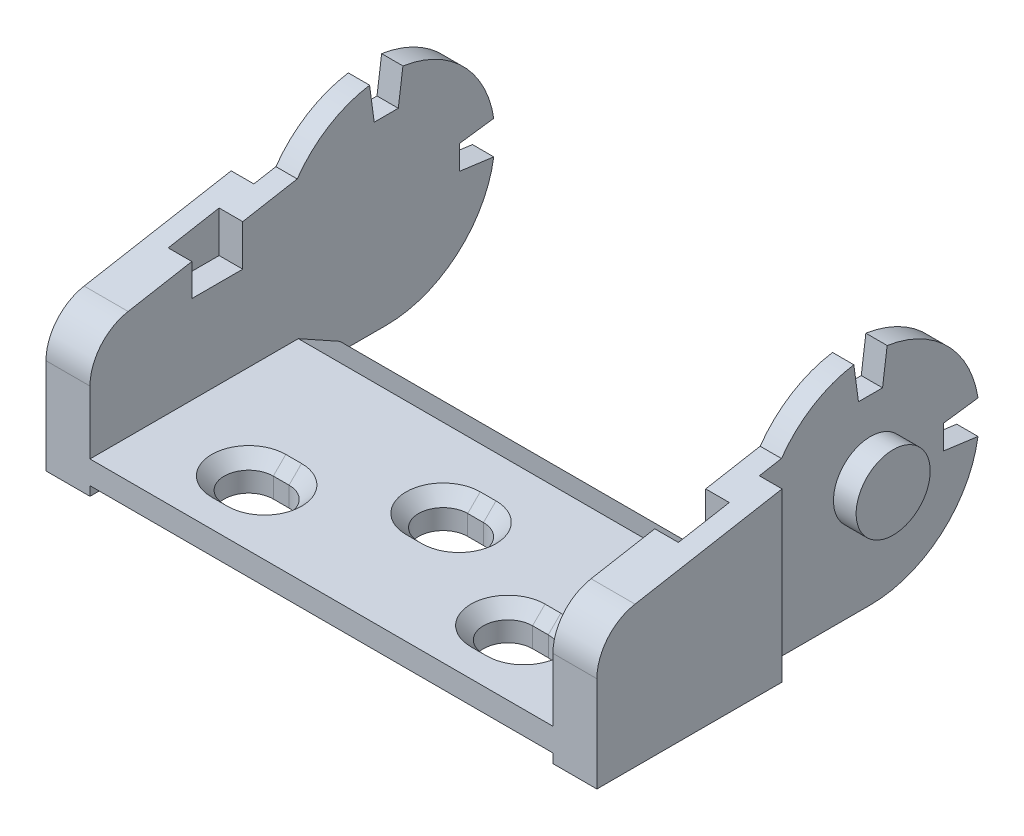
from build123d import *

# Parameters (mm, degrees)
BODY_DEPTH                       = 32
BODY_DEPTH_BACK                  = 15
PIVOT_START                      = 25
PIVOT_PIN_R_SKETCH_R             = 4
PIVOT_PIN_R_DEPTH                = 4.25
OUTSIDE_SHAPE_CUT_OUT_DEPTH      = 46.245165488
OUTSIDE_SHAPE_CUT_OUT_DEPTH_BACK = 46.245165488
OUTSIDE_SHAPE_CUT_OUT_SKETCH_W   = 49
OUTSIDE_SHAPE_CUT_OUT_SKETCH_H   = 25.5
OUTSIDE_START                    = 27.3
OUTSIDE_SHAPE_CUT_OUT_SKETCH_R_W = 24
OUTSIDE_SHAPE_CUT_OUT_SKETCH_R_H = 24
OUTSIDE_SHAPE_CUT_OUT_SKETCH_R_R = 4
OUTSIDE_SHAPE_CUT_OUT_R_DEPTH    = 18.945165488
INSIDE_START                     = 25
INSIDE_SHAPE_CUT_OUT_DEPTH       = 50
LIGHTENING_START                 = 1.25
LIGHTENING_2_SKETCH_W            = 55.1
LIGHTENING_2_SKETCH_H            = 5.5
LIGHTENING_2_DEPTH               = 44.995165488
F_3_START                        = -11.75
F_3_M5_SLOTS_DEPTH               = 3.5


with BuildPart() as part:
    # Profile Sketch → Body (new, two sides: drawn at the far end of the back side and taken through both)
    with BuildSketch(Plane.XY.offset(-BODY_DEPTH_BACK)):
        Polygon((-29.75, -11.75), (29.75, -11.75), (29.75, 11.75), (25, 11.75), (25, -8.25), (-25, -8.25), (-25, 11.75), (-29.75, 11.75), align=None)
    extrude(amount=BODY_DEPTH + BODY_DEPTH_BACK)

    # Pivot Pin R Sketch → Pivot Pin R (add)
    with BuildSketch(Plane(origin=(0, 0, 0), x_dir=(0, 0, -1), z_dir=(1, 0, 0)).offset(PIVOT_START)):
        Circle(PIVOT_PIN_R_SKETCH_R)
    pivot_pin_r = extrude(amount=PIVOT_PIN_R_DEPTH)

    # Pivot Pin L: Pivot Pin R across plane
    add(pivot_pin_r.mirror(Plane(origin=(0, 0, 0), x_dir=(0, 0, 1), z_dir=(1, 0, 0))))

    # Outside Shape Cut Out Sketch → Outside Shape Cut Out (cut, two sides: drawn at the far end of the back side and taken through both)
    with BuildSketch(Plane(origin=(0, 0, 0), x_dir=(0, 0, -1), z_dir=(1, 0, 0)).offset(-OUTSIDE_SHAPE_CUT_OUT_DEPTH_BACK)):
        with Locations((-9.5, -1)):
            Rectangle(OUTSIDE_SHAPE_CUT_OUT_SKETCH_W, OUTSIDE_SHAPE_CUT_OUT_SKETCH_H)
        with BuildLine():
            Line((-27.879626464, 3.486362585), (-9.617692031, 6.75))
            ThreePointArc((-9.617692031, 6.75), (-6.204756601, 9.978150907), (-1.8, 11.611309142))
            Line((-1.8, 11.611309142), (-1.3, 7.9))
            Line((-1.3, 7.9), (1.3, 7.9))
            Line((1.3, 7.9), (1.8, 11.611309142))
            ThreePointArc((1.8, 11.611309142), (8.308504679, 8.308504679), (11.611309142, 1.8))
            Line((11.611309142, 1.8), (7.9, 1.3))
            Line((7.9, 1.3), (7.9, -1.3))
            Line((7.9, -1.3), (11.611309142, -1.8))
            ThreePointArc((11.611309142, -1.8), (7.645668708, -8.922233465), (0, -11.75))
            Line((0, -11.75), (-32, -11.75))
            Line((-32, -11.75), (-32, -1.435655018))
            ThreePointArc((-32, -1.435655018), (-30.833936118, 1.773851772), (-27.879626464, 3.486362585))
        make_face(mode=Mode.SUBTRACT)
    extrude(amount=OUTSIDE_SHAPE_CUT_OUT_DEPTH + OUTSIDE_SHAPE_CUT_OUT_DEPTH_BACK, mode=Mode.SUBTRACT)

    # Outside Shape Cut Out Sketch R → Outside Shape Cut Out R (cut, through all)
    with BuildSketch(Plane(origin=(0, 0, 0), x_dir=(0, 0, -1), z_dir=(1, 0, 0)).offset(OUTSIDE_START)):
        Rectangle(OUTSIDE_SHAPE_CUT_OUT_SKETCH_R_W, OUTSIDE_SHAPE_CUT_OUT_SKETCH_R_H)
        Circle(OUTSIDE_SHAPE_CUT_OUT_SKETCH_R_R, mode=Mode.SUBTRACT)
    outside_shape_cut_out_r = extrude(amount=OUTSIDE_SHAPE_CUT_OUT_R_DEPTH, mode=Mode.SUBTRACT)

    # Outside Shape Cut Out L: Outside Shape Cut Out R across plane
    add(outside_shape_cut_out_r.mirror(Plane(origin=(0, 0, 0), x_dir=(0, 0, 1), z_dir=(1, 0, 0))), mode=Mode.SUBTRACT)

    # Inside Shape Cut Out Sketch → Inside Shape Cut Out (cut)
    with BuildSketch(Plane(origin=(0, 0, 0), x_dir=(0, 0, -1), z_dir=(1, 0, 0)).offset(INSIDE_START)):
        Polygon((-29, -9.75), (-29, -11.75), (-32, -11.75), (-32, -10.75), (-30.5, -10.75), (-30.5, -9.75), align=None)
        Polygon((-9.5, -8.25), (-5, -10.75), (-5, -11.75), (8.366600265, -11.75), (8.366600265, -8.25), align=None)
    extrude(amount=-INSIDE_SHAPE_CUT_OUT_DEPTH, mode=Mode.SUBTRACT)

    # Lightening 2 Sketch → Lightening 2 (cut, through all)
    with BuildSketch(Plane(origin=(0, 0, 0), x_dir=(1, 0, 0), z_dir=(0, 1, 0)).offset(LIGHTENING_START)):
        with Locations((0, -18.25)):
            Rectangle(LIGHTENING_2_SKETCH_W, LIGHTENING_2_SKETCH_H)
    extrude(amount=LIGHTENING_2_DEPTH, mode=Mode.SUBTRACT)

    # 3 M5 Slots: read off the stored shape, not the designer's step
    # 3 M5 Slots outline → 3 M5 Slots (cut)
    with BuildSketch(Plane(origin=(0, 0, 0), x_dir=(1, 0, 0), z_dir=(0, 1, 0)).offset(F_3_START)):
        with BuildLine():
            Line((-0.85, -20.65), (0.85, -20.65))
            ThreePointArc((0.85, -20.65), (3.5, -18), (0.85, -15.35))
            Line((0.85, -15.35), (-0.85, -15.35))
            ThreePointArc((-0.85, -15.35), (-3.5, -18), (-0.85, -20.65))
        make_face()
        with BuildLine():
            Line((13.15, -27.65), (14.85, -27.65))
            ThreePointArc((14.85, -27.65), (17.5, -25), (14.85, -22.35))
            Line((14.85, -22.35), (13.15, -22.35))
            ThreePointArc((13.15, -22.35), (10.5, -25), (13.15, -27.65))
        make_face()
        with BuildLine():
            ThreePointArc((-13.15, -27.65), (-10.5, -25), (-13.15, -22.35))
            Line((-13.15, -22.35), (-14.85, -22.35))
            ThreePointArc((-14.85, -22.35), (-17.5, -25), (-14.85, -27.65))
            Line((-14.85, -27.65), (-13.15, -27.65))
        make_face()
    extrude(amount=F_3_M5_SLOTS_DEPTH, mode=Mode.SUBTRACT)

    # 3 M5 Slots 2: loft between two sections, ruled curve by curve
    f_3_m5_slots_2_from = [
        Edge.make_three_point_arc((0.85, -9.6, 20.65), (2.72383297, -9.6, 19.87383297), (3.5, -9.6, 18)),
        Edge.make_three_point_arc((3.5, -9.6, 18), (2.72383297, -9.6, 16.12616703), (0.85, -9.6, 15.35)),
        Edge.make_three_point_arc((-0.85, -9.6, 15.35), (-2.72383297, -9.6, 16.12616703), (-3.5, -9.6, 18)),
        Edge.make_three_point_arc((-3.5, -9.6, 18), (-2.72383297, -9.6, 19.87383297), (-0.85, -9.6, 20.65)),
        Edge.make_line((0.85, -9.6, 15.35), (-0.85, -9.6, 15.35)),
        Edge.make_line((0.85, -9.6, 20.65), (-0.85, -9.6, 20.65)),
    ]
    f_3_m5_slots_2_to = [
        Edge.make_three_point_arc((0.85, -8.25, 22), (3.678427125, -8.25, 20.828427125), (4.85, -8.25, 18)),
        Edge.make_three_point_arc((4.85, -8.25, 18), (3.678427125, -8.25, 15.171572875), (0.85, -8.25, 14)),
        Edge.make_three_point_arc((-0.85, -8.25, 14), (-3.678427125, -8.25, 15.171572875), (-4.85, -8.25, 18)),
        Edge.make_three_point_arc((-4.85, -8.25, 18), (-3.678427125, -8.25, 20.828427125), (-0.85, -8.25, 22)),
        Edge.make_line((0.85, -8.25, 14), (-0.85, -8.25, 14)),
        Edge.make_line((0.85, -8.25, 22), (-0.85, -8.25, 22)),
    ]
    f_3_m5_slots_2 = Solid(Shell([*[Face.make_surface_from_curves(f_3_m5_slots_2_from[k], f_3_m5_slots_2_to[k]) for k in range(6)], Face(Wire(f_3_m5_slots_2_from)), Face(Wire(f_3_m5_slots_2_to))]))
    add(f_3_m5_slots_2, mode=Mode.SUBTRACT)

    # 3 M5 Slots 3: loft between two sections, ruled curve by curve
    f_3_m5_slots_3_from = [
        Edge.make_three_point_arc((14.85, -9.6, 27.65), (16.72383297, -9.6, 26.87383297), (17.5, -9.6, 25)),
        Edge.make_three_point_arc((17.5, -9.6, 25), (16.72383297, -9.6, 23.12616703), (14.85, -9.6, 22.35)),
        Edge.make_three_point_arc((13.15, -9.6, 22.35), (11.27616703, -9.6, 23.12616703), (10.5, -9.6, 25)),
        Edge.make_three_point_arc((10.5, -9.6, 25), (11.27616703, -9.6, 26.87383297), (13.15, -9.6, 27.65)),
        Edge.make_line((14.85, -9.6, 22.35), (13.15, -9.6, 22.35)),
        Edge.make_line((14.85, -9.6, 27.65), (13.15, -9.6, 27.65)),
    ]
    f_3_m5_slots_3_to = [
        Edge.make_three_point_arc((14.85, -8.25, 29), (17.678427125, -8.25, 27.828427125), (18.85, -8.25, 25)),
        Edge.make_three_point_arc((18.85, -8.25, 25), (17.678427125, -8.25, 22.171572875), (14.85, -8.25, 21)),
        Edge.make_three_point_arc((13.15, -8.25, 21), (10.321572875, -8.25, 22.171572875), (9.15, -8.25, 25)),
        Edge.make_three_point_arc((9.15, -8.25, 25), (10.321572875, -8.25, 27.828427125), (13.15, -8.25, 29)),
        Edge.make_line((14.85, -8.25, 21), (13.15, -8.25, 21)),
        Edge.make_line((14.85, -8.25, 29), (13.15, -8.25, 29)),
    ]
    f_3_m5_slots_3 = Solid(Shell([*[Face.make_surface_from_curves(f_3_m5_slots_3_from[k], f_3_m5_slots_3_to[k]) for k in range(6)], Face(Wire(f_3_m5_slots_3_from)), Face(Wire(f_3_m5_slots_3_to))]))
    add(f_3_m5_slots_3, mode=Mode.SUBTRACT)

    # 3 M5 Slots 4: loft between two sections, ruled curve by curve
    f_3_m5_slots_4_from = [
        Edge.make_three_point_arc((-13.15, -9.6, 27.65), (-11.27616703, -9.6, 26.87383297), (-10.5, -9.6, 25)),
        Edge.make_three_point_arc((-10.5, -9.6, 25), (-11.27616703, -9.6, 23.12616703), (-13.15, -9.6, 22.35)),
        Edge.make_three_point_arc((-14.85, -9.6, 22.35), (-16.72383297, -9.6, 23.12616703), (-17.5, -9.6, 25)),
        Edge.make_three_point_arc((-17.5, -9.6, 25), (-16.72383297, -9.6, 26.87383297), (-14.85, -9.6, 27.65)),
        Edge.make_line((-13.15, -9.6, 22.35), (-14.85, -9.6, 22.35)),
        Edge.make_line((-13.15, -9.6, 27.65), (-14.85, -9.6, 27.65)),
    ]
    f_3_m5_slots_4_to = [
        Edge.make_three_point_arc((-13.15, -8.25, 29), (-10.321572875, -8.25, 27.828427125), (-9.15, -8.25, 25)),
        Edge.make_three_point_arc((-9.15, -8.25, 25), (-10.321572875, -8.25, 22.171572875), (-13.15, -8.25, 21)),
        Edge.make_three_point_arc((-14.85, -8.25, 21), (-17.678427125, -8.25, 22.171572875), (-18.85, -8.25, 25)),
        Edge.make_three_point_arc((-18.85, -8.25, 25), (-17.678427125, -8.25, 27.828427125), (-14.85, -8.25, 29)),
        Edge.make_line((-13.15, -8.25, 21), (-14.85, -8.25, 21)),
        Edge.make_line((-13.15, -8.25, 29), (-14.85, -8.25, 29)),
    ]
    f_3_m5_slots_4 = Solid(Shell([*[Face.make_surface_from_curves(f_3_m5_slots_4_from[k], f_3_m5_slots_4_to[k]) for k in range(6)], Face(Wire(f_3_m5_slots_4_from)), Face(Wire(f_3_m5_slots_4_to))]))
    add(f_3_m5_slots_4, mode=Mode.SUBTRACT)


solid = part.part
